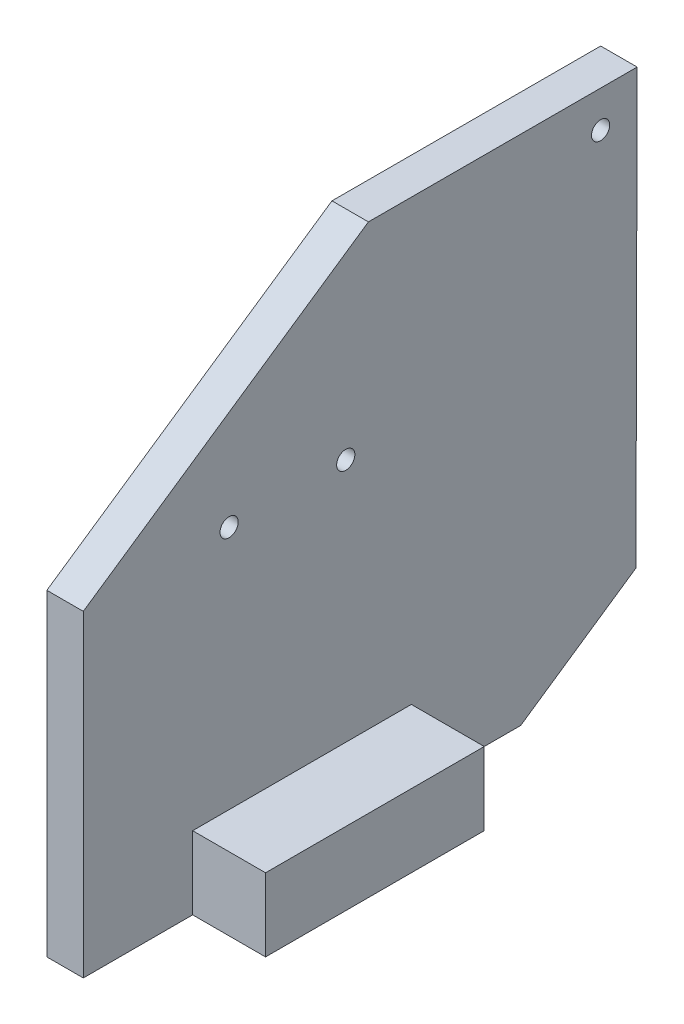
from build123d import *

# Parameters (mm, degrees)
SKETCH2_R           = 1.5875
BOSS_EXTRUDE3_DEPTH = 6.35
SKETCH2_5_W         = 38.1
SKETCH2_5_H         = 12.7
BOSS_EXTRUDE4_DEPTH = 12.7


with BuildPart() as part:
    # Sketch2 → Boss-Extrude3 (new body)
    with BuildSketch(Plane(origin=(0, 0, 0), x_dir=(0, 0, -1), z_dir=(1, 0, 0))):
        Polygon((0, 55.3212), (0, 0), (76.2, 0), (96.279058859, 13.713894127), (96.486676864, 89.198386962), (49.670010733, 89.245562356), align=None)
        with Locations((25.4, 55.3212)):
            Circle(SKETCH2_R, mode=Mode.SUBTRACT)
        with Locations((45.72, 55.3212)):
            Circle(SKETCH2_R, mode=Mode.SUBTRACT)
        with Locations((90.119204984, 82.8548)):
            Circle(SKETCH2_R, mode=Mode.SUBTRACT)
    extrude(amount=-BOSS_EXTRUDE3_DEPTH)

    # Sketch2<5> → Boss-Extrude4 (add)
    with BuildSketch(Plane(origin=(0, 0, 0), x_dir=(0, 0, -1), z_dir=(1, 0, 0))):
        with Locations((38.1, 6.35)):
            Rectangle(SKETCH2_5_W, SKETCH2_5_H)
    extrude(amount=BOSS_EXTRUDE4_DEPTH)


solid = part.part
